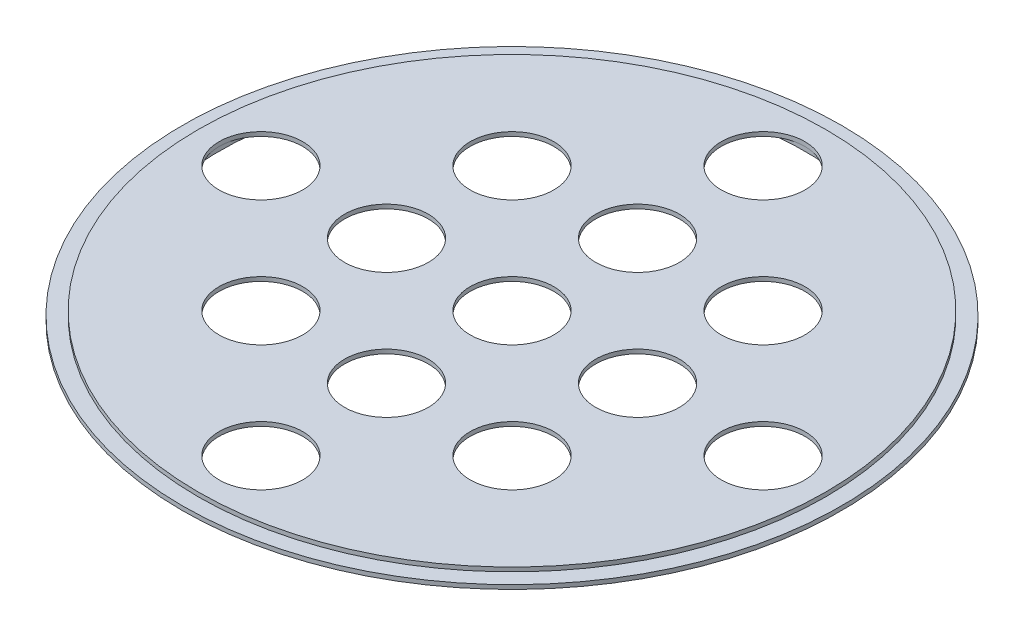
from build123d import *

# Parameters (mm, degrees)
SKETCH2_R               = 7.5
BOSS_EXTRUDE1_DEPTH     = 0.1
SKETCH3_R               = 1
CUT_EXTRUDE2_DEPTH      = 11.607073112
FILL_PATTERN3_OUTLINE_R = 1
FILL_PATTERN3_DEPTH     = 0.1
SKETCH5_R               = 7.874751998
SKETCH5_R_2             = 7
BOSS_EXTRUDE2_DEPTH     = 0.1


# Read off the part's stored shape, not the designer's step: Fill Pattern3
with BuildPart() as part:
    # Sketch2 → Boss-Extrude1 (new body)
    with BuildSketch(Plane(origin=(0, 0, 0), x_dir=(1, 0, 0), z_dir=(0, 1, 0))):
        with Locations(Location((0, 0, 0), (0, 0, 270))):
            Circle(SKETCH2_R)
    extrude(amount=BOSS_EXTRUDE1_DEPTH)

    # Sketch3 → Cut-Extrude2 (cut, through all)
    with BuildSketch(Plane(origin=(0, 0, 0), x_dir=(1, 0, 0), z_dir=(0, 1, 0))):
        with Locations(Location((0, 0, 0), (0, 0, 270))):
            Circle(SKETCH3_R)
    extrude(amount=CUT_EXTRUDE2_DEPTH, mode=Mode.SUBTRACT)

    # Fill Pattern3 outline → Fill Pattern3 (cut)
    with BuildSketch(Plane(origin=(0, 0, 0), x_dir=(1, 0, 0), z_dir=(0, 1, 0))):
        with Locations((3, -3)):
            Circle(FILL_PATTERN3_OUTLINE_R)
        with Locations((0, -3)):
            Circle(FILL_PATTERN3_OUTLINE_R)
        with Locations((-3, -3)):
            Circle(FILL_PATTERN3_OUTLINE_R)
        with Locations((-3, 0)):
            Circle(FILL_PATTERN3_OUTLINE_R)
        with Locations((-3, 3)):
            Circle(FILL_PATTERN3_OUTLINE_R)
        with Locations((0, 3)):
            Circle(FILL_PATTERN3_OUTLINE_R)
        with Locations((6, 0)):
            Circle(FILL_PATTERN3_OUTLINE_R)
        with Locations((0, 6)):
            Circle(FILL_PATTERN3_OUTLINE_R)
        with Locations((-6, 0)):
            Circle(FILL_PATTERN3_OUTLINE_R)
        with Locations((0, -6)):
            Circle(FILL_PATTERN3_OUTLINE_R)
        with Locations((3, 0)):
            Circle(FILL_PATTERN3_OUTLINE_R)
        with Locations((3, 3)):
            Circle(FILL_PATTERN3_OUTLINE_R)
    extrude(amount=FILL_PATTERN3_DEPTH, mode=Mode.SUBTRACT)

    # Sketch5 → Boss-Extrude2 (add)
    with BuildSketch(Plane(origin=(0, 0, 0), x_dir=(1, 0, 0), z_dir=(0, 1, 0))):
        with Locations(Location((0, 0, 0), (0, 0, 270))):
            Circle(SKETCH5_R)
        with Locations(Location((0, 0, 0), (0, 0, 270))):
            Circle(SKETCH5_R_2, mode=Mode.SUBTRACT)
    extrude(amount=-BOSS_EXTRUDE2_DEPTH)


solid = part.part
